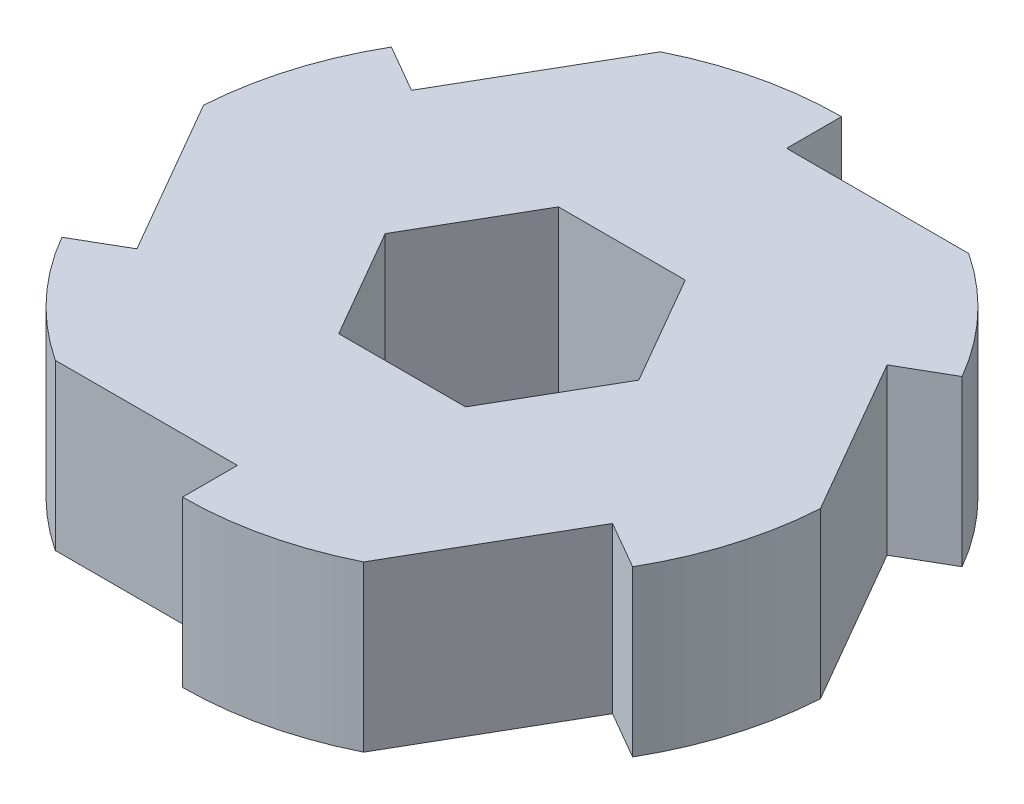
from build123d import *

# Parameters (mm, degrees)
SKETCH2_R           = 19.05
BOSS_EXTRUDE2_DEPTH = 9.525
CUT_EXTRUDE1_DEPTH  = 29.575
CIRPATTERN1_COUNT   = 6
CUT_EXTRUDE2_DEPTH  = 29.550543201


with BuildPart() as part:
    # Sketch2 → Boss-Extrude2 (new body)
    with BuildSketch(Plane(origin=(0, 0, 0), x_dir=(1, 0, 0), z_dir=(0, 1, 0))):
        Circle(SKETCH2_R)
    extrude(amount=BOSS_EXTRUDE2_DEPTH)

    # Sketch3 → Cut-Extrude1 (cut, symmetric)
    with BuildSketch(Plane(origin=(0, 9.525, 0), x_dir=(1, 0, 0), z_dir=(0, 1, 0))):
        Polygon((0, 120.586851799), (0, 19.05), (0, 15.875), (10.530283709, 15.875), (112.067135509, 15.875), (250.709992792, 164.25655956), (138.642857283, 268.96841136), align=None)
    cut_extrude1 = extrude(amount=CUT_EXTRUDE1_DEPTH, both=True, mode=Mode.SUBTRACT)

    # CirPattern1: Cut-Extrude1 ×6 about axis
    cirpattern1_axis = Axis((0, 9.525, 0), (0, -1, 0))
    for i in range(1, CIRPATTERN1_COUNT):
        add(cut_extrude1.rotate(cirpattern1_axis, i * 360 / CIRPATTERN1_COUNT), mode=Mode.SUBTRACT)

    # Sketch4 → Cut-Extrude2 (cut, through all)
    with BuildSketch(Plane(origin=(0, 9.525, 0), x_dir=(1, 0, 0), z_dir=(0, 1, 0))):
        Polygon((7.332348419, 0), (3.666174209, 6.35), (-3.666174209, 6.35), (-7.332348419, 0), (-3.666174209, -6.35), (3.666174209, -6.35), align=None)
    extrude(amount=-CUT_EXTRUDE2_DEPTH, mode=Mode.SUBTRACT)


solid = part.part
